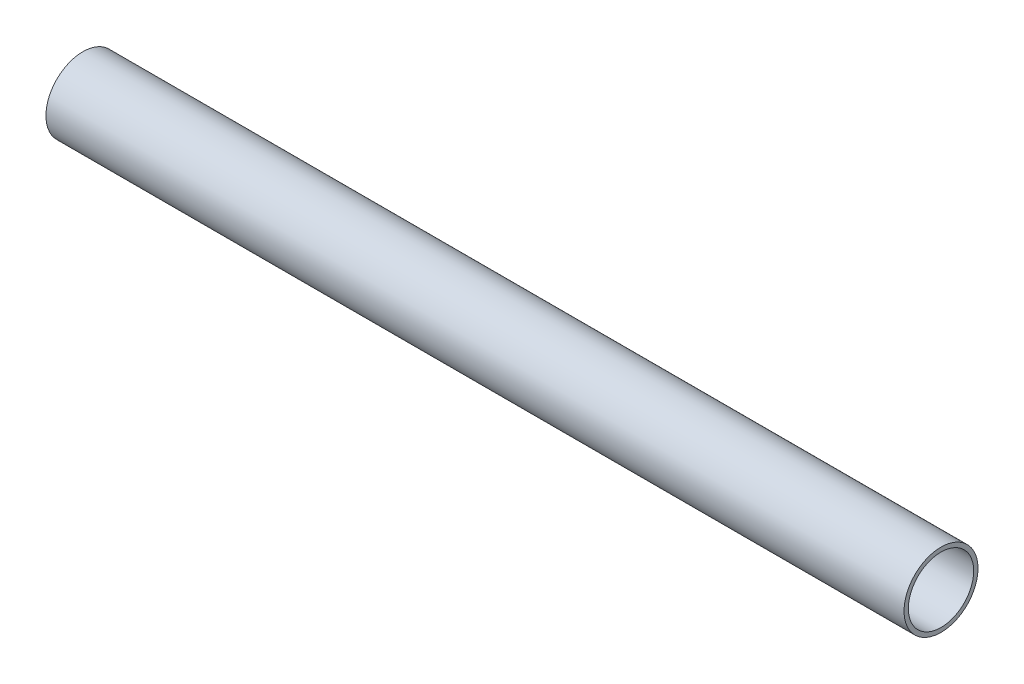
from build123d import *

# Parameters (mm, degrees)
CROQUIS2_R              = 86.2
CROQUIS2_R_2            = 76.2
SALIENTE_EXTRUIR1_DEPTH = 2000


with BuildPart() as part:
    # Croquis2 → Saliente-Extruir1 (new body)
    with BuildSketch(Plane(origin=(0, 0, 0), x_dir=(0, 0, -1), z_dir=(1, 0, 0))):
        Circle(CROQUIS2_R)
        Circle(CROQUIS2_R_2, mode=Mode.SUBTRACT)
    extrude(amount=SALIENTE_EXTRUIR1_DEPTH)


solid = part.part
